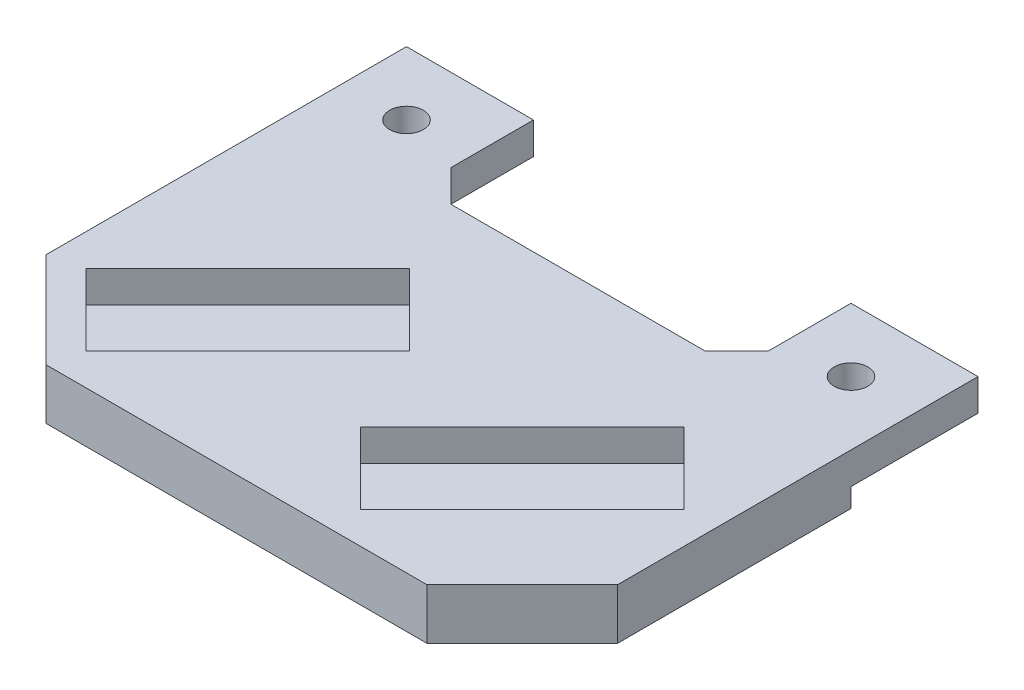
from build123d import *

# Parameters (mm, degrees)
SKETCH1_W           = 90
SKETCH1_H           = 71.769552622
SKETCH1_R           = 2.65
BOSS_EXTRUDE1_DEPTH = 5
SKETCH2_W           = 90
SKETCH2_H           = 51.769552622
BOSS_EXTRUDE2_DEPTH = 3
SKETCH3_W           = 50
SKETCH3_H           = 18
CUT_EXTRUDE1_DEPTH  = 5
CHAMFER1_SIZE       = 5
CHAMFER2_SIZE       = 15


with BuildPart() as part:
    # Sketch1 → Boss-Extrude1 (new body)
    with BuildSketch(Plane(origin=(0, 0, 0), x_dir=(1, 0, 0), z_dir=(0, 1, 0))):
        with Locations((45, -15.884776311)):
            Rectangle(SKETCH1_W, SKETCH1_H)
        with Locations((10, 10)):
            Circle(SKETCH1_R, mode=Mode.SUBTRACT)
        with Locations((80, 10)):
            Circle(SKETCH1_R, mode=Mode.SUBTRACT)
        Polygon((48.230447378, -35.455844123), (73.686291501, -10), (85, -21.313708499), (59.544155877, -46.769552622), align=None, mode=Mode.SUBTRACT)
        Polygon((16.313708499, -46.769552622), (5, -35.455844123), (30.455844123, -10), (41.769552622, -21.313708499), align=None, mode=Mode.SUBTRACT)
    extrude(amount=BOSS_EXTRUDE1_DEPTH)

    # Sketch2 → Boss-Extrude2 (add)
    with BuildSketch(Plane.XZ):
        with Locations((45, 25.884776311)):
            Rectangle(SKETCH2_W, SKETCH2_H)
    extrude(amount=BOSS_EXTRUDE2_DEPTH)

    # Sketch3 → Cut-Extrude1 (cut)
    with BuildSketch(Plane(origin=(0, 5, 0), x_dir=(1, 0, 0), z_dir=(0, 1, 0))):
        with Locations((45, 11)):
            Rectangle(SKETCH3_W, SKETCH3_H)
    extrude(amount=-CUT_EXTRUDE1_DEPTH, mode=Mode.SUBTRACT)

    # Chamfer1
    chamfer1_edges = [part.edges().sort_by_distance(p)[0] for p in [
        (20, 2.5, -2),
        (70, 2.5, -2),
    ]]
    chamfer(chamfer1_edges, length=CHAMFER1_SIZE)

    # Chamfer2
    chamfer2_edges = [part.edges().sort_by_distance(p)[0] for p in [
        (90, 1, 51.769552622),
        (0, 1, 51.769552622),
    ]]
    chamfer(chamfer2_edges, length=CHAMFER2_SIZE)


solid = part.part
